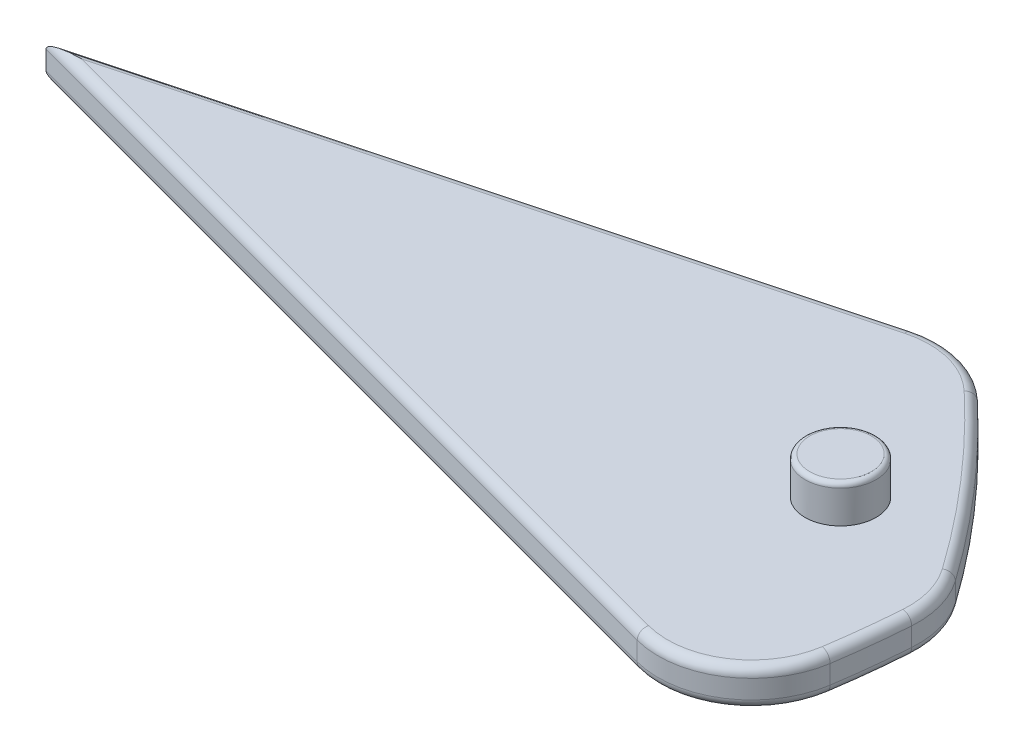
from build123d import *

# Parameters (mm, degrees)
BOSS_EXTRUDE2_DEPTH = 1
BOSS_EXTRUDE3_DEPTH = 1
CUT_EXTRUDE3_START  = -2
CUT_EXTRUDE3_DEPTH  = 2
FILLET1_R           = 5
FILLET2_R           = 0.5
SKETCH2_R           = 1.9
BOSS_EXTRUDE4_DEPTH = 2
FILLET3_R           = 0.25


# Read off the part's stored shape, not the designer's step: Cut-Extrude3
with BuildPart() as part:
    # Sketch1 → Boss-Extrude2 (new, symmetric)
    with BuildSketch(Plane(origin=(0, 0, 0), x_dir=(1, 0, 0), z_dir=(0, 1, 0))):
        with BuildLine():
            Line((48.296291314, -12.940952255), (0, 0))
            Line((0, 0), (48.296291314, 12.940952255))
            ThreePointArc((48.296291314, 12.940952255), (50, 0), (48.296291314, -12.940952255))
        make_face()
    extrude(amount=BOSS_EXTRUDE2_DEPTH, both=True)

    # Sketch3 → Boss-Extrude3 (add)
    with BuildSketch(Plane(origin=(0, -1, 0), x_dir=(-1, 0, 0), z_dir=(0, -1, 0))):
        with BuildLine():
            Line((-38.5, -7), (-38.5, 7))
            ThreePointArc((-38.5, 7), (-38, 7.5), (-37.5, 7))
            Line((-37.5, 7), (-37.5, -7))
            ThreePointArc((-37.5, -7), (-38, -7.5), (-38.5, -7))
        make_face()
    extrude(amount=BOSS_EXTRUDE3_DEPTH)

    # Cut-Extrude3 outline → Cut-Extrude3 (cut)
    with BuildSketch(Plane(origin=(0, 1, 0), x_dir=(1, 0, 0), z_dir=(0, 1, 0)).offset(CUT_EXTRUDE3_START)):
        with BuildLine():
            ThreePointArc((39.129720832, 10.484777097), (44.969397941, 4.720942194), (49.96810207, -1.785714286))
            ThreePointArc((49.96810207, -1.785714286), (49.680896013, 5.639908806), (48.296291314, 12.940952255))
            Line((48.296291314, 12.940952255), (39.129720832, 10.484777097))
        make_face()
    extrude(amount=CUT_EXTRUDE3_DEPTH, mode=Mode.SUBTRACT)

    # Fillet1
    fillet1_edges = [part.edges().sort_by_distance(p)[0] for p in [
        (39.129720832, 0, -10.484777097),
        (49.96810207, 0, 1.785714286),
        (48.296291314, 0, 12.940952255),
    ]]
    fillet(fillet1_edges, radius=FILLET1_R)

    # Fillet2
    fillet2_edges = [part.edges().sort_by_distance(p)[0] for p in [
        (18.252899917, -1, -4.890849792),
        (18.252899917, 1, -4.890849792),
        (45.320316883, -1, -4.32008237),
        (49.692435611, -1, 5.537313704),
        (21.598758088, -1, 5.787369787),
        (47.228674266, -1, 10.929424828),
        (49.700770587, -1, 1.869330184),
        (39.027043508, -1, -9.799142423),
        (45.320316883, 1, -4.32008237),
        (21.598758088, 1, 5.787369787),
        (49.692435611, 1, 5.537313704),
        (47.228674266, 1, 10.929424828),
        (49.700770587, 1, 1.869330184),
        (39.027043508, 1, -9.799142423),
    ]]
    fillet(fillet2_edges, radius=FILLET2_R)

    # Sketch2 → Boss-Extrude4 (add)
    with BuildSketch(Plane(origin=(0, 1, 0), x_dir=(1, 0, 0), z_dir=(0, 1, 0))):
        with Locations(Location((42.5, 0, 0), (0, 0, 90))):
            Circle(SKETCH2_R)
    extrude(amount=BOSS_EXTRUDE4_DEPTH)

    # Fillet3
    fillet3_edges = [part.edges().sort_by_distance(p)[0] for p in [
        (42.5, 3, 1.9),
    ]]
    fillet(fillet3_edges, radius=FILLET3_R)


solid = part.part
